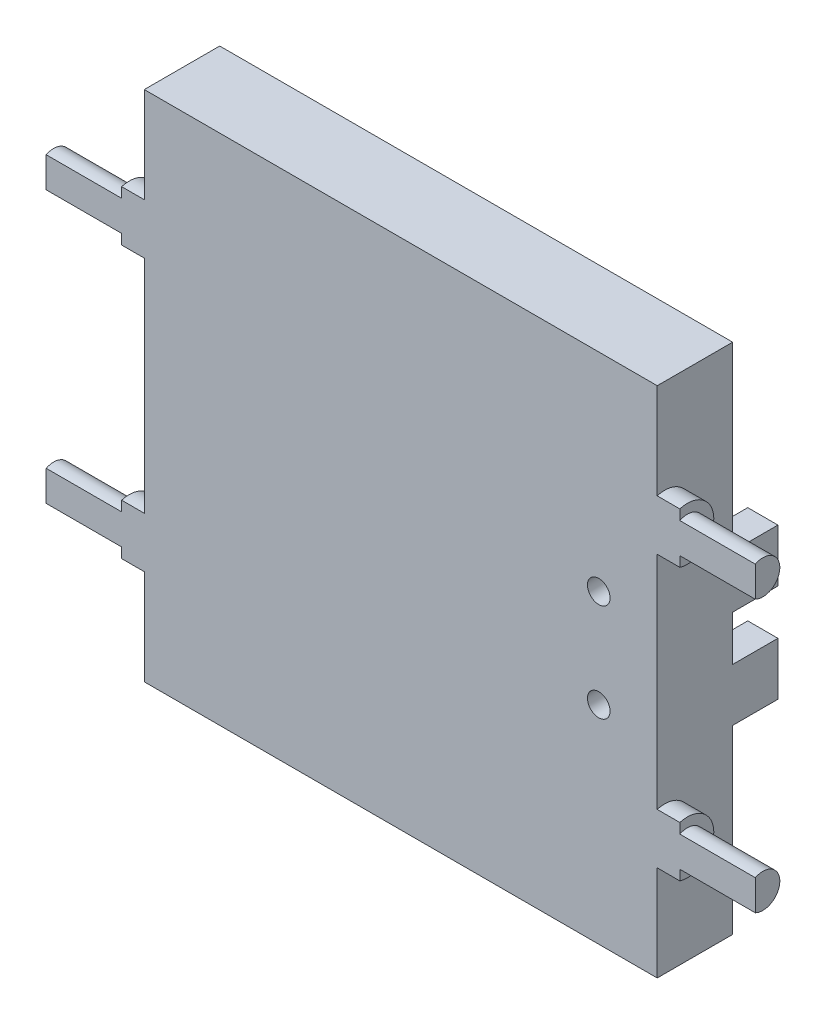
from build123d import *

# Parameters (mm, degrees)
SKETCH1_W           = 68
SKETCH1_H           = 68
BOSS_EXTRUDE1_DEPTH = 10
BOSS_EXTRUDE2_DEPTH = 3
BOSS_EXTRUDE3_DEPTH = 10
BOSS_EXTRUDE4_START = 3
BOSS_EXTRUDE4_DEPTH = 3
BOSS_EXTRUDE5_START = 10
BOSS_EXTRUDE5_DEPTH = 10
SKETCH6_W           = 42.5
SKETCH6_H           = 42.5
CUT_EXTRUDE1_DEPTH  = 3
SKETCH8_R           = 1.5
CUT_EXTRUDE2_DEPTH  = 5
SKETCH9_W           = 4
SKETCH9_H           = 7
BOSS_EXTRUDE6_DEPTH = 6
SKETCH10_R          = 1.5
CUT_EXTRUDE3_DEPTH  = 10


with BuildPart() as part:
    # Sketch1 → Boss-Extrude1 (new body)
    with BuildSketch(Plane.XY):
        with Locations((-34, -34)):
            Rectangle(SKETCH1_W, SKETCH1_H)
    extrude(amount=BOSS_EXTRUDE1_DEPTH)

    # Sketch2 → Boss-Extrude2 (add)
    with BuildSketch(Plane.ZY.offset(68)):
        with BuildLine():
            Line((10, -55.354101966), (10, -48.645898034))
            ThreePointArc((10, -48.645898034), (5.5, -52), (10, -55.354101966))
        make_face()
        with BuildLine():
            Line((10, -19.354101966), (10, -12.645898034))
            ThreePointArc((10, -12.645898034), (5.5, -16), (10, -19.354101966))
        make_face()
    extrude(amount=BOSS_EXTRUDE2_DEPTH)

    # Sketch3 → Boss-Extrude3 (add)
    with BuildSketch(Plane.ZY.offset(71)):
        with BuildLine():
            ThreePointArc((10, -49.984435563), (6.75, -52), (10, -54.015564437))
            Line((10, -54.015564437), (10, -49.984435563))
        make_face()
        with BuildLine():
            ThreePointArc((10, -13.984435563), (6.75, -16), (10, -18.015564437))
            Line((10, -18.015564437), (10, -13.984435563))
        make_face()
    extrude(amount=BOSS_EXTRUDE3_DEPTH)

    # Sketch4 → Boss-Extrude4 (add)
    with BuildSketch(Plane(origin=(0, 0, 0), x_dir=(0, 0, -1), z_dir=(1, 0, 0)).offset(BOSS_EXTRUDE4_START)):
        with BuildLine():
            ThreePointArc((-10, -19.354101966), (-5.5, -16), (-10, -12.645898034))
            Line((-10, -12.645898034), (-10, -19.354101966))
        make_face()
        with BuildLine():
            ThreePointArc((-10, -55.354101966), (-5.5, -52), (-10, -48.645898034))
            Line((-10, -48.645898034), (-10, -55.354101966))
        make_face()
    extrude(amount=-BOSS_EXTRUDE4_DEPTH)

    # Sketch5 → Boss-Extrude5 (add)
    with BuildSketch(Plane(origin=(3, 0, 0), x_dir=(0, 0, -1), z_dir=(1, 0, 0)).offset(BOSS_EXTRUDE5_START)):
        with BuildLine():
            ThreePointArc((-10, -18.015564437), (-6.75, -16), (-10, -13.984435563))
            Line((-10, -13.984435563), (-10, -18.015564437))
        make_face()
        with BuildLine():
            ThreePointArc((-10, -54.015564437), (-6.75, -52), (-10, -49.984435563))
            Line((-10, -49.984435563), (-10, -54.015564437))
        make_face()
    extrude(amount=-BOSS_EXTRUDE5_DEPTH)

    # Sketch6 → Cut-Extrude1 (cut)
    with BuildSketch(Plane(origin=(0, 0, 0), x_dir=(-1, 0, 0), z_dir=(0, 0, -1))):
        with Locations((34, -34)):
            Rectangle(SKETCH6_W, SKETCH6_H)
    extrude(amount=-CUT_EXTRUDE1_DEPTH, mode=Mode.SUBTRACT)

    # Sketch8 → Cut-Extrude2 (cut)
    with BuildSketch(Plane(origin=(0, 0, 0), x_dir=(-1, 0, 0), z_dir=(0, 0, -1))):
        with Locations((4.75, -17.75)):
            Circle(SKETCH8_R)
        with Locations((4.75, -50.25)):
            Circle(SKETCH8_R)
        with Locations((63.25, -50.25)):
            Circle(SKETCH8_R)
        with Locations((63.25, -17.75)):
            Circle(SKETCH8_R)
    extrude(amount=-CUT_EXTRUDE2_DEPTH, mode=Mode.SUBTRACT)

    # Sketch9 → Boss-Extrude6 (add)
    with BuildSketch(Plane(origin=(0, 0, 0), x_dir=(-1, 0, 0), z_dir=(0, 0, -1))):
        with Locations((2, -27.5)):
            Rectangle(SKETCH9_W, SKETCH9_H)
        with Locations((2, -40.5)):
            Rectangle(SKETCH9_W, SKETCH9_H)
    extrude(amount=BOSS_EXTRUDE6_DEPTH)

    # Sketch10 → Cut-Extrude3 (cut)
    with BuildSketch(Plane(origin=(0, 0, 0), x_dir=(-1, 0, 0), z_dir=(0, 0, -1))):
        with Locations((7.75, -27.5)):
            Circle(SKETCH10_R)
        with Locations((7.75, -40.5)):
            Circle(SKETCH10_R)
    extrude(amount=-CUT_EXTRUDE3_DEPTH, mode=Mode.SUBTRACT)


solid = part.part
